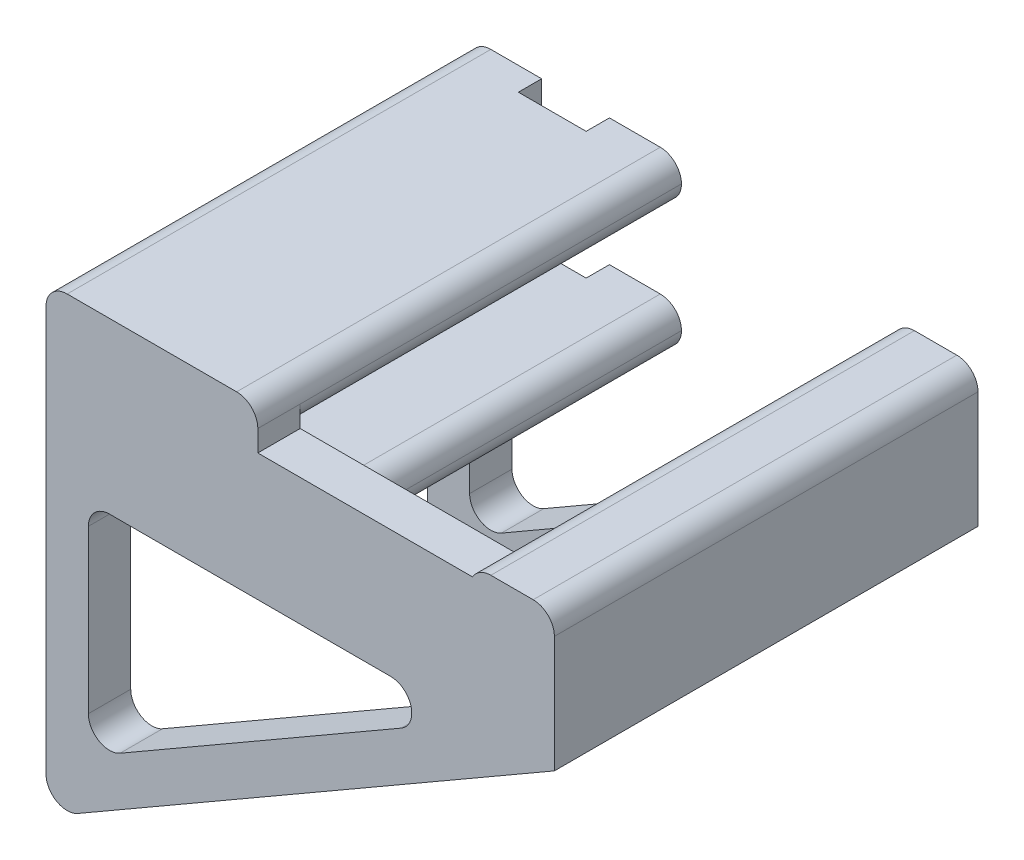
from build123d import *

# Parameters (mm, degrees)
SKETCH1_W           = 14
SKETCH1_H           = 22
SKETCH1_W_2         = 10
SKETCH1_H_2         = 18
EXTRUDE_THIN1_DEPTH = 2
SKETCH2_W           = 2
SKETCH2_H           = 22
BOSS_EXTRUDE1_DEPTH = 4.5
SKETCH3_W           = 22
SKETCH3_H           = 8
SKETCH3_W_2         = 18
SKETCH3_H_2         = 4
EXTRUDE_THIN2_DEPTH = 2
SKETCH4_W           = 2
SKETCH4_H           = 10.076871622
CUT_EXTRUDE1_DEPTH  = 26.690465157
SKETCH5_W           = 1.1
SKETCH5_H           = 4.2
SKETCH5_H_2         = 2
CUT_EXTRUDE2_DEPTH  = 1.1
BOSS_EXTRUDE2_DEPTH = 8
SKETCH7_W           = 2.5
SKETCH7_H           = 1.1
SKETCH7_W_2         = 0.9
BOSS_EXTRUDE3_DEPTH = 8
CUT_EXTRUDE3_DEPTH  = 1.1
BOSS_EXTRUDE4_REACH = 25.065
SKETCH9_W           = 2
SKETCH9_H           = 4
BOSS_EXTRUDE5_DEPTH = 2
SKETCH11_W          = 0.9
SKETCH11_H          = 4.2
BOSS_EXTRUDE6_DEPTH = 1.1
EXTRUDE_THIN4_DEPTH = 2
LPATTERN1_COUNT     = 2
LPATTERN1_PITCH     = 18
SKETCH14_W          = 2.2
SKETCH14_H          = 4.2
CUT_EXTRUDE4_DEPTH  = 2
FILLET1_R           = 1


with BuildPart() as part:
    # Sketch1 → Extrude-Thin1 (new body)
    with BuildSketch(Plane(origin=(0, 0, 0), x_dir=(1, 0, 0), z_dir=(0, 1, 0))):
        with Locations((5, 9)):
            Rectangle(SKETCH1_W, SKETCH1_H)
        with Locations((5, 9)):
            Rectangle(SKETCH1_W_2, SKETCH1_H_2, mode=Mode.SUBTRACT)
    extrude(amount=EXTRUDE_THIN1_DEPTH)

    # Sketch2 → Boss-Extrude1 (add)
    with BuildSketch(Plane(origin=(0, 2, 0), x_dir=(1, 0, 0), z_dir=(0, 1, 0))):
        with Locations((11, 9)):
            Rectangle(SKETCH2_W, SKETCH2_H)
    extrude(amount=BOSS_EXTRUDE1_DEPTH)

    # Sketch3 → Extrude-Thin2 (add)
    with BuildSketch(Plane.ZY.offset(2)):
        with Locations((-9, 4)):
            Rectangle(SKETCH3_W, SKETCH3_H)
        with Locations((-9, 4)):
            Rectangle(SKETCH3_W_2, SKETCH3_H_2, mode=Mode.SUBTRACT)
    extrude(amount=-EXTRUDE_THIN2_DEPTH)

    # Sketch4 → Cut-Extrude1 (cut, through all)
    with BuildSketch(Plane(origin=(12, 0, 0), x_dir=(0, 0, -1), z_dir=(1, 0, 0))):
        with Locations((19, 5.038435811)):
            Rectangle(SKETCH4_W, SKETCH4_H)
    extrude(amount=-CUT_EXTRUDE1_DEPTH, mode=Mode.SUBTRACT)

    # Sketch5 → Cut-Extrude2 (cut)
    with BuildSketch(Plane(origin=(0, 0, -18), x_dir=(-1, 0, 0), z_dir=(0, 0, -1))):
        with Locations((-11.45, 3)):
            Rectangle(SKETCH5_W, SKETCH5_H)
        with Locations((1.45, 7)):
            Rectangle(SKETCH5_W, SKETCH5_H_2)
        with Locations((1.45, 1)):
            Rectangle(SKETCH5_W, SKETCH5_H_2)
    extrude(amount=-CUT_EXTRUDE2_DEPTH, mode=Mode.SUBTRACT)

    # Sketch6 → Boss-Extrude2 (add)
    with BuildSketch(Plane.ZY.offset(2)):
        Polygon((-16.9, 2), (-16.9, 0), (2, 0), (2, 8), (-16.9, 8), (-16.9, 6), (0, 6), (0, 2), align=None)
    extrude(amount=BOSS_EXTRUDE2_DEPTH)

    # Sketch7 → Boss-Extrude3 (add, through all)
    with BuildSketch(Plane(origin=(0, 8, 0), x_dir=(1, 0, 0), z_dir=(0, 1, 0))):
        with Locations((-2.15, 17.45)):
            Rectangle(SKETCH7_W, SKETCH7_H)
        with Locations((-7.85, 17.45)):
            Rectangle(SKETCH7_W, SKETCH7_H)
        with Locations((-9.55, 17.45)):
            Rectangle(SKETCH7_W_2, SKETCH7_H)
    extrude(amount=-BOSS_EXTRUDE3_DEPTH)

    # Sketch8 → Cut-Extrude3 (cut)
    with BuildSketch(Plane(origin=(0, 0, -18), x_dir=(-1, 0, 0), z_dir=(0, 0, -1))):
        Polygon((6.6, 6), (0.9, 6), (0.9, 2), (6.6, 4.505494505), align=None)
        Polygon((6.6, 4.505494505), (0.9, 2), (6.6, 2), align=None)
        Polygon((10, 2), (10, 6), (6.6, 4.505494505), (6.6, 2), align=None)
        Polygon((10, 6), (6.6, 6), (6.6, 4.505494505), align=None)
    extrude(amount=-CUT_EXTRUDE3_DEPTH, mode=Mode.SUBTRACT)

    # Sketch9 → Boss-Extrude4 (add, up to next)
    with BuildSketch(Plane(origin=(0, 0, 0), x_dir=(0, 0, -1), z_dir=(1, 0, 0)), mode=Mode.PRIVATE) as boss_extrude4_sk1:
        with Locations((-1, 4)):
            Rectangle(SKETCH9_W, SKETCH9_H)
    boss_extrude4_tool1 = extrude(boss_extrude4_sk1.sketch, amount=BOSS_EXTRUDE4_REACH, mode=Mode.PRIVATE) - part.part
    add(boss_extrude4_tool1.solids().sort_by_distance((0, 4, 1))[0])

    # Sketch10 → Boss-Extrude5 (add)
    with BuildSketch(Plane(origin=(12, 0, 0), x_dir=(0, 0, -1), z_dir=(1, 0, 0))):
        Polygon((-2, 6.5), (-2, 0), (18, 0), (18, 0.9), (16.9, 0.9), (16.9, 5.1), (18, 5.1), (18, 6.5), align=None)
    extrude(amount=BOSS_EXTRUDE5_DEPTH)

    # Sketch11 → Boss-Extrude6 (add)
    with BuildSketch(Plane(origin=(0, 0, -16.9), x_dir=(-1, 0, 0), z_dir=(0, 0, -1))):
        with Locations((-13.55, 3)):
            Rectangle(SKETCH11_W, SKETCH11_H)
    extrude(amount=BOSS_EXTRUDE6_DEPTH)

    # Sketch13 → Extrude-Thin4 (add)
    with BuildSketch(Plane.XY.offset(2)):
        Polygon((-10, 0), (-10, -13.856406461), (14, 0), (13, 1.732050808), (-8, -10.392304845), (-8, 0), align=None)
    extrude_thin4 = extrude(amount=-EXTRUDE_THIN4_DEPTH)

    # LPattern1: Extrude-Thin4 ×2
    with Locations(*[(0, 0, -i * LPATTERN1_PITCH) for i in range(1, LPATTERN1_COUNT)]):
        add(extrude_thin4)

    # Sketch14 → Cut-Extrude4 (cut)
    with BuildSketch(Plane(origin=(0, 0, -16.9), x_dir=(-1, 0, 0), z_dir=(0, 0, -1))):
        with Locations((-12, 3)):
            Rectangle(SKETCH14_W, SKETCH14_H)
    extrude(amount=CUT_EXTRUDE4_DEPTH, mode=Mode.SUBTRACT)

    # Fillet1
    # the kernel refuses this fillet: 1 mm, written as the material it adds along each edge
    with BuildSketch(Plane(origin=(10, 0, 0), x_dir=(-0.866025403784438, -0.500000000000001, 0), z_dir=(0, 0, 1))) as fillet1_piece_1:
        with BuildLine():
            CenterArc((FILLET1_R * 3.73205080757, -FILLET1_R), FILLET1_R, 90, 150)
            Line((FILLET1_R * 3.23205080757, -FILLET1_R * 1.86602540378), (0, 0))
            Line((0, 0), (FILLET1_R * 3.73205080757, 0))
        make_face()
    extrude(amount=2)
    with BuildSketch(Plane(origin=(-8, -10.392304845, 2), x_dir=(0.8660254037844376, 0.5000000000000017, 0), z_dir=(0, 0, -1))) as fillet1_piece_2:
        with BuildLine():
            CenterArc((FILLET1_R * 1.73205080757, -FILLET1_R), FILLET1_R, 90, 120)
            Line((FILLET1_R * 0.866025403784, -FILLET1_R * 1.5), (0, 0))
            Line((0, 0), (FILLET1_R * 1.73205080757, 0))
        make_face()
    extrude(amount=2)
    with BuildSketch(Plane(origin=(-8, 0, 2), x_dir=(0, -1, 0), z_dir=(0, 0, -1)), Plane(origin=(-8, 0, -16), x_dir=(0, -1, 0), z_dir=(0, 0, -1))) as fillet1_piece_3:
        with BuildLine():
            CenterArc((FILLET1_R, -FILLET1_R), FILLET1_R, 90, 90)
            Line((0, -FILLET1_R), (0, 0))
            Line((0, 0), (FILLET1_R, 0))
        make_face()
    extrude(amount=2)
    with BuildSketch(Plane(origin=(10, 0, -16), x_dir=(0, 1, 0), z_dir=(0, 0, -1))) as fillet1_piece_4:
        with BuildLine():
            CenterArc((FILLET1_R * 0.57735026919, -FILLET1_R), FILLET1_R, 90, 60)
            Line((-FILLET1_R * 0.288675134595, -FILLET1_R * 0.5), (0, 0))
            Line((0, 0), (FILLET1_R * 0.57735026919, 0))
        make_face()
    extrude(amount=2)
    with BuildSketch(Plane(origin=(-8, -10.392304845, -16), x_dir=(0, 1, 0), z_dir=(0, 0, -1))) as fillet1_piece_5:
        with BuildLine():
            CenterArc((FILLET1_R * 1.73205080757, FILLET1_R), FILLET1_R, 150, 120)
            Line((FILLET1_R * 0.866025403784, FILLET1_R * 1.5), (0, 0))
            Line((0, 0), (FILLET1_R * 1.73205080757, 0))
        make_face()
    extrude(amount=2)
    # the kernel refuses this fillet: 1 mm, written as the material it takes off along each edge
    with BuildSketch(Plane(origin=(0, 0, -20.5), x_dir=(-1, 0, 0), z_dir=(0, 0, 1)), Plane(origin=(-10, 2, 0), x_dir=(0, -1, 0), z_dir=(0, 0, -1))) as fillet1_2_piece_1:
        with BuildLine():
            CenterArc((FILLET1_R, -FILLET1_R), FILLET1_R, 90, 90)
            Line((0, -FILLET1_R), (0, 0))
            Line((0, 0), (FILLET1_R, 0))
        make_face()
    extrude(amount=20.5, mode=Mode.SUBTRACT)
    with BuildSketch(Plane(origin=(0, 2, -20.5), x_dir=(-1, 0, 0), z_dir=(0, 0, 1)), Plane(origin=(-10, 6, -20.5), x_dir=(1, 0, 0), z_dir=(0, 0, 1)), Plane(origin=(0, 6, 0), x_dir=(-1, 0, 0), z_dir=(0, 0, -1))) as fillet1_2_piece_2:
        with BuildLine():
            CenterArc((FILLET1_R, FILLET1_R), FILLET1_R, 180, 90)
            Line((0, FILLET1_R), (0, 0))
            Line((0, 0), (FILLET1_R, 0))
        make_face()
    extrude(amount=20.5, mode=Mode.SUBTRACT)
    with BuildSketch(Plane(origin=(-10, 8, 4.5), x_dir=(1, 0, 0), z_dir=(0, 0, -1)), Plane(origin=(14, 6.5, -20.5), x_dir=(-1, 0, 0), z_dir=(0, 0, 1))) as fillet1_2_piece_3:
        with BuildLine():
            CenterArc((FILLET1_R, FILLET1_R), FILLET1_R, 180, 90)
            Line((0, FILLET1_R), (0, 0))
            Line((0, 0), (FILLET1_R, 0))
        make_face()
    extrude(amount=25, mode=Mode.SUBTRACT)
    with BuildSketch(Plane(origin=(-10, -13.856406461, 6.330127019), x_dir=(0.866025403784438, 0.5000000000000009, 0), z_dir=(0, 0, -1))) as fillet1_2_piece_4:
        with BuildLine():
            CenterArc((FILLET1_R * 1.73205080757, -FILLET1_R), FILLET1_R, 90, 120)
            Line((FILLET1_R * 0.866025403784, -FILLET1_R * 1.5), (0, 0))
            Line((0, 0), (FILLET1_R * 1.73205080757, 0))
        make_face()
    extrude(amount=10.660254038, mode=Mode.SUBTRACT)
    with BuildSketch(Plane(origin=(0, 8, 4.5), x_dir=(-1, 0, 0), z_dir=(0, 0, -1))) as fillet1_2_piece_5:
        with BuildLine():
            CenterArc((FILLET1_R, -FILLET1_R), FILLET1_R, 90, 90)
            Line((0, -FILLET1_R), (0, 0))
            Line((0, 0), (FILLET1_R, 0))
        make_face()
    extrude(amount=25, mode=Mode.SUBTRACT)
    with BuildSketch(Plane(origin=(10, 6.5, -20.5), x_dir=(1, 0, 0), z_dir=(0, 0, 1))) as fillet1_2_piece_6_section:
        with BuildLine():
            CenterArc((FILLET1_R, -FILLET1_R), FILLET1_R, 90, 90)
            Line((0, -FILLET1_R), (0, 0))
            Line((0, 0), (FILLET1_R, 0))
        make_face()
    fillet1_2_piece_6 = extrude(amount=25, mode=Mode.PRIVATE)
    fillet1_2_piece_6 = split(fillet1_2_piece_6, bisect_by=Plane(origin=(10.244024849, 6, -9), z_dir=(0, 1, 0)), keep=Keep.TOP, mode=Mode.PRIVATE)
    add(fillet1_2_piece_6, mode=Mode.SUBTRACT)
    with BuildSketch(Plane(origin=(10, 6.5, -20.5), x_dir=(1, 0, 0), z_dir=(0, 0, 1))) as fillet1_2_piece_7_section:
        with BuildLine():
            CenterArc((FILLET1_R, -FILLET1_R), FILLET1_R, 90, 90)
            Line((0, -FILLET1_R), (0, 0))
            Line((0, 0), (FILLET1_R, 0))
        make_face()
    fillet1_2_piece_7 = extrude(amount=25, mode=Mode.PRIVATE)
    fillet1_2_piece_7 = split(fillet1_2_piece_7, bisect_by=Plane(origin=(10.039684593, 5.876736387, 0), z_dir=(0, 0, -1)), keep=Keep.TOP, mode=Mode.PRIVATE)
    add(fillet1_2_piece_7, mode=Mode.SUBTRACT)
    with BuildSketch(Plane(origin=(-10, 0, 0), x_dir=(1, 0, 0), z_dir=(0, 0, -1))) as fillet1_2_piece_8:
        with BuildLine():
            CenterArc((FILLET1_R, -FILLET1_R), FILLET1_R, 90, 90)
            Line((0, -FILLET1_R), (0, 0))
            Line((0, 0), (FILLET1_R, 0))
        make_face()
    extrude(amount=16, mode=Mode.SUBTRACT)
    with BuildSketch(Plane(origin=(-10, -13.856406461, -11.669872981), x_dir=(0, 1, 0), z_dir=(0, 0, -1))) as fillet1_2_piece_9:
        with BuildLine():
            CenterArc((FILLET1_R * 1.73205080757, FILLET1_R), FILLET1_R, 150, 120)
            Line((FILLET1_R * 0.866025403784, FILLET1_R * 1.5), (0, 0))
            Line((0, 0), (FILLET1_R * 1.73205080757, 0))
        make_face()
    extrude(amount=10.660254038, mode=Mode.SUBTRACT)


solid = part.part
